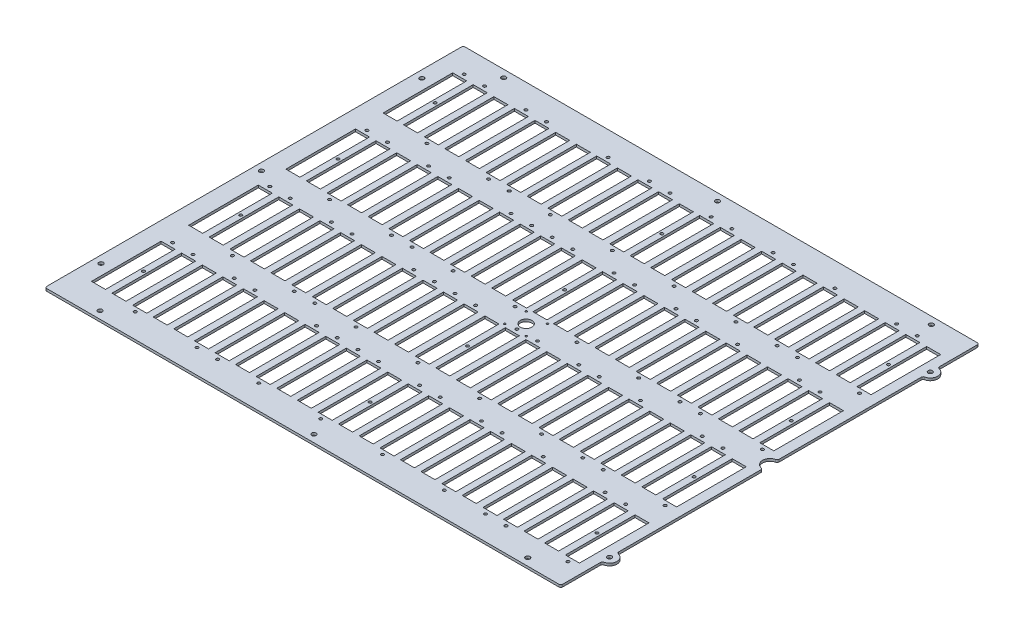
from build123d import *

# Parameters (mm, degrees)
BOSS_EXTRUDE1_DEPTH        = 3.175
SKETCH2_R                  = 1.905
SKETCH2_W                  = 18.288
SKETCH2_H                  = 90.932
CUT_EXTRUDE1_DEPTH         = 3.175
F_1_0_228_DIAMETER_HOLE1_D = 5.7912
FILLET1_R                  = 2.54
CUT_EXTRUDE3_OUTLINE_W     = 18.288
CUT_EXTRUDE3_OUTLINE_H     = 90.932
CUT_EXTRUDE3_OUTLINE_R     = 1.89865
CUT_EXTRUDE3_OUTLINE_R_2   = 2.8956
CUT_EXTRUDE3_OUTLINE_R_3   = 1.905
CUT_EXTRUDE3_DEPTH         = 3.175
CUT_EXTRUDE4_OUTLINE_R     = 1.2192
CUT_EXTRUDE4_OUTLINE_R_2   = 7.62
CUT_EXTRUDE4_DEPTH         = 3.175


# Read off the part's stored shape, not the designer's step: Cut-Extrude3, Cut-Extrude4
with BuildPart() as part:
    # Sketch1 → Boss-Extrude1 (new body)
    with BuildSketch(Plane(origin=(0, 0, 0), x_dir=(1, 0, 0), z_dir=(0, 1, 0))):
        with BuildLine():
            Line((337.058, 219.202), (337.058, 273.304))
            Line((337.058, 273.304), (-337.058, 273.304))
            Line((-337.058, 273.304), (-337.058, -273.304))
            Line((-337.058, -273.304), (337.058, -273.304))
            Line((337.058, -273.304), (337.058, -219.202))
            ThreePointArc((337.058, -219.202), (346.71, -209.55), (337.058, -199.898))
            Line((337.058, -199.898), (337.058, -9.652))
            ThreePointArc((337.058, -9.652), (327.406, 0), (337.058, 9.652))
            Line((337.058, 9.652), (337.058, 199.898))
            ThreePointArc((337.058, 199.898), (346.71, 209.55), (337.058, 219.202))
        make_face()
    extrude(amount=BOSS_EXTRUDE1_DEPTH)

    # Sketch2 → Cut-Extrude1 (cut)
    with BuildSketch(Plane(origin=(0, 3.175, 0), x_dir=(1, 0, 0), z_dir=(0, 1, 0))):
        with Locations(Location((-304.313166667, 241.808, 0), (0, 0, 270))):
            Circle(SKETCH2_R)
        with Locations(Location((-250.465166667, 139.192, 0), (0, 0, 270))):
            Circle(SKETCH2_R)
        with Locations(Location((-169.693166667, 139.192, 0), (0, 0, 270))):
            Circle(SKETCH2_R)
        with Locations(Location((-169.693166667, 12.192, 0), (0, 0, 270))):
            Circle(SKETCH2_R)
        with Locations(Location((-196.7865, 241.808, 0), (0, 0, 270))):
            Circle(SKETCH2_R)
        with Locations(Location((-169.693166667, -114.808, 0), (0, 0, 270))):
            Circle(SKETCH2_R)
        with Locations(Location((-169.693166667, -241.808, 0), (0, 0, 270))):
            Circle(SKETCH2_R)
        with Locations(Location((-116.1415, 241.808, 0), (0, 0, 270))):
            Circle(SKETCH2_R)
        with Locations(Location((-250.465166667, 12.192, 0), (0, 0, 270))):
            Circle(SKETCH2_R)
        with Locations(Location((-250.465166667, -114.808, 0), (0, 0, 270))):
            Circle(SKETCH2_R)
        with Locations(Location((-250.465166667, -241.808, 0), (0, 0, 270))):
            Circle(SKETCH2_R)
        with Locations(Location((-277.5585, 241.808, 0), (0, 0, 270))):
            Circle(SKETCH2_R)
        with Locations(Location((-277.5585, 114.808, 0), (0, 0, 270))):
            Circle(SKETCH2_R)
        with Locations(Location((-277.5585, -12.192, 0), (0, 0, 270))):
            Circle(SKETCH2_R)
        with Locations(Location((-277.5585, -139.192, 0), (0, 0, 270))):
            Circle(SKETCH2_R)
        with Locations(Location((-142.769166667, 139.192, 0), (0, 0, 270))):
            Circle(SKETCH2_R)
        with Locations(Location((-142.769166667, 12.192, 0), (0, 0, 270))):
            Circle(SKETCH2_R)
        with Locations(Location((-142.769166667, -114.808, 0), (0, 0, 270))):
            Circle(SKETCH2_R)
        with Locations(Location((-142.769166667, -241.808, 0), (0, 0, 270))):
            Circle(SKETCH2_R)
        with Locations(Location((-62.2935, 241.808, 0), (0, 0, 270))):
            Circle(SKETCH2_R)
        with Locations(Location((-62.2935, 114.808, 0), (0, 0, 270))):
            Circle(SKETCH2_R)
        with Locations(Location((-62.2935, -12.192, 0), (0, 0, 270))):
            Circle(SKETCH2_R)
        with Locations(Location((-62.2935, -139.192, 0), (0, 0, 270))):
            Circle(SKETCH2_R)
        with Locations(Location((-35.3695, 241.808, 0), (0, 0, 270))):
            Circle(SKETCH2_R)
        with Locations(Location((-35.3695, 114.808, 0), (0, 0, 270))):
            Circle(SKETCH2_R)
        with Locations(Location((-35.3695, -12.192, 0), (0, 0, 270))):
            Circle(SKETCH2_R)
        with Locations(Location((-35.3695, -139.192, 0), (0, 0, 270))):
            Circle(SKETCH2_R)
        with Locations(Location((-196.7865, 114.808, 0), (0, 0, 270))):
            Circle(SKETCH2_R)
        with Locations(Location((-8.149166667, 139.192, 0), (0, 0, 270))):
            Circle(SKETCH2_R)
        with Locations(Location((-8.149166667, 12.192, 0), (0, 0, 270))):
            Circle(SKETCH2_R)
        with Locations(Location((-116.1415, 114.808, 0), (0, 0, 270))):
            Circle(SKETCH2_R)
        with Locations(Location((-8.149166667, -114.808, 0), (0, 0, 270))):
            Circle(SKETCH2_R)
        with Locations(Location((-8.149166667, -241.808, 0), (0, 0, 270))):
            Circle(SKETCH2_R)
        with Locations(Location((18.4785, 241.808, 0), (0, 0, 270))):
            Circle(SKETCH2_R)
        with Locations(Location((18.4785, 114.808, 0), (0, 0, 270))):
            Circle(SKETCH2_R)
        with Locations(Location((18.4785, -12.192, 0), (0, 0, 270))):
            Circle(SKETCH2_R)
        with Locations(Location((18.4785, -139.192, 0), (0, 0, 270))):
            Circle(SKETCH2_R)
        with Locations(Location((45.4025, 241.808, 0), (0, 0, 270))):
            Circle(SKETCH2_R)
        with Locations(Location((45.4025, 114.808, 0), (0, 0, 270))):
            Circle(SKETCH2_R)
        with Locations(Location((45.4025, -12.192, 0), (0, 0, 270))):
            Circle(SKETCH2_R)
        with Locations(Location((45.4025, -139.192, 0), (0, 0, 270))):
            Circle(SKETCH2_R)
        with Locations(Location((126.1745, 241.808, 0), (0, 0, 270))):
            Circle(SKETCH2_R)
        with Locations(Location((126.1745, 114.808, 0), (0, 0, 270))):
            Circle(SKETCH2_R)
        with Locations(Location((126.1745, -12.192, 0), (0, 0, 270))):
            Circle(SKETCH2_R)
        with Locations(Location((126.1745, -139.192, 0), (0, 0, 270))):
            Circle(SKETCH2_R)
        with Locations(Location((180.0225, 241.808, 0), (0, 0, 270))):
            Circle(SKETCH2_R)
        with Locations(Location((180.0225, 114.808, 0), (0, 0, 270))):
            Circle(SKETCH2_R)
        with Locations(Location((180.0225, -12.192, 0), (0, 0, 270))):
            Circle(SKETCH2_R)
        with Locations(Location((180.0225, -139.192, 0), (0, 0, 270))):
            Circle(SKETCH2_R)
        with Locations(Location((260.7945, 241.808, 0), (0, 0, 270))):
            Circle(SKETCH2_R)
        with Locations(Location((-196.7865, -12.192, 0), (0, 0, 270))):
            Circle(SKETCH2_R)
        with Locations(Location((260.7945, 114.808, 0), (0, 0, 270))):
            Circle(SKETCH2_R)
        with Locations(Location((260.7945, -12.192, 0), (0, 0, 270))):
            Circle(SKETCH2_R)
        with Locations(Location((-116.1415, -12.192, 0), (0, 0, 270))):
            Circle(SKETCH2_R)
        with Locations(Location((260.7945, -139.192, 0), (0, 0, 270))):
            Circle(SKETCH2_R)
        with Locations(Location((287.7185, 241.808, 0), (0, 0, 270))):
            Circle(SKETCH2_R)
        with Locations(Location((287.7185, 114.808, 0), (0, 0, 270))):
            Circle(SKETCH2_R)
        with Locations(Location((287.7185, -12.192, 0), (0, 0, 270))):
            Circle(SKETCH2_R)
        with Locations(Location((287.7185, -139.192, 0), (0, 0, 270))):
            Circle(SKETCH2_R)
        with Locations(Location((72.622833333, 139.192, 0), (0, 0, 270))):
            Circle(SKETCH2_R)
        with Locations(Location((72.622833333, 12.192, 0), (0, 0, 270))):
            Circle(SKETCH2_R)
        with Locations(Location((72.622833333, -114.808, 0), (0, 0, 270))):
            Circle(SKETCH2_R)
        with Locations(Location((72.622833333, -241.808, 0), (0, 0, 270))):
            Circle(SKETCH2_R)
        with Locations(Location((153.394833333, 139.192, 0), (0, 0, 270))):
            Circle(SKETCH2_R)
        with Locations(Location((153.394833333, 12.192, 0), (0, 0, 270))):
            Circle(SKETCH2_R)
        with Locations(Location((153.394833333, -114.808, 0), (0, 0, 270))):
            Circle(SKETCH2_R)
        with Locations(Location((153.394833333, -241.808, 0), (0, 0, 270))):
            Circle(SKETCH2_R)
        with Locations(Location((207.242833333, 139.192, 0), (0, 0, 270))):
            Circle(SKETCH2_R)
        with Locations(Location((207.242833333, 12.192, 0), (0, 0, 270))):
            Circle(SKETCH2_R)
        with Locations(Location((207.242833333, -114.808, 0), (0, 0, 270))):
            Circle(SKETCH2_R)
        with Locations(Location((207.242833333, -241.808, 0), (0, 0, 270))):
            Circle(SKETCH2_R)
        with Locations(Location((314.938833333, 139.192, 0), (0, 0, 270))):
            Circle(SKETCH2_R)
        with Locations(Location((314.938833333, 12.192, 0), (0, 0, 270))):
            Circle(SKETCH2_R)
        with Locations(Location((-196.7865, -139.192, 0), (0, 0, 270))):
            Circle(SKETCH2_R)
        with Locations(Location((314.938833333, -114.808, 0), (0, 0, 270))):
            Circle(SKETCH2_R)
        with Locations(Location((314.938833333, -241.808, 0), (0, 0, 270))):
            Circle(SKETCH2_R)
        with Locations(Location((-116.1415, -139.192, 0), (0, 0, 270))):
            Circle(SKETCH2_R)
        with Locations(Location((-304.313166667, 114.808, 0), (0, 0, 270))):
            Circle(SKETCH2_R)
        with Locations(Location((-304.313166667, -12.192, 0), (0, 0, 270))):
            Circle(SKETCH2_R)
        with Locations(Location((-304.313166667, -139.192, 0), (0, 0, 270))):
            Circle(SKETCH2_R)
        with Locations((-250.465166667, 190.5)):
            Rectangle(SKETCH2_W, SKETCH2_H)
        with Locations((-169.693166667, 190.5)):
            Rectangle(SKETCH2_W, SKETCH2_H)
        with Locations((-304.313166667, 190.5)):
            Rectangle(SKETCH2_W, SKETCH2_H)
        with Locations((-169.693166667, 63.5)):
            Rectangle(SKETCH2_W, SKETCH2_H)
        with Locations((-169.693166667, -63.5)):
            Rectangle(SKETCH2_W, SKETCH2_H)
        with Locations((-196.7865, 190.5)):
            Rectangle(SKETCH2_W, SKETCH2_H)
        with Locations((-169.693166667, -190.5)):
            Rectangle(SKETCH2_W, SKETCH2_H)
        with Locations((-250.465166667, 63.5)):
            Rectangle(SKETCH2_W, SKETCH2_H)
        with Locations((-116.1415, 190.5)):
            Rectangle(SKETCH2_W, SKETCH2_H)
        with Locations((-250.465166667, -63.5)):
            Rectangle(SKETCH2_W, SKETCH2_H)
        with Locations((-250.465166667, -190.5)):
            Rectangle(SKETCH2_W, SKETCH2_H)
        with Locations((-277.5585, 190.5)):
            Rectangle(SKETCH2_W, SKETCH2_H)
        with Locations((-277.5585, 63.5)):
            Rectangle(SKETCH2_W, SKETCH2_H)
        with Locations((-277.5585, -63.5)):
            Rectangle(SKETCH2_W, SKETCH2_H)
        with Locations((-277.5585, -190.5)):
            Rectangle(SKETCH2_W, SKETCH2_H)
        with Locations((-142.769166667, 190.5)):
            Rectangle(SKETCH2_W, SKETCH2_H)
        with Locations((-142.769166667, 63.5)):
            Rectangle(SKETCH2_W, SKETCH2_H)
        with Locations((-142.769166667, -63.5)):
            Rectangle(SKETCH2_W, SKETCH2_H)
        with Locations((-142.769166667, -190.5)):
            Rectangle(SKETCH2_W, SKETCH2_H)
        with Locations((-62.2935, 190.5)):
            Rectangle(SKETCH2_W, SKETCH2_H)
        with Locations((-62.2935, 63.5)):
            Rectangle(SKETCH2_W, SKETCH2_H)
        with Locations((-62.2935, -63.5)):
            Rectangle(SKETCH2_W, SKETCH2_H)
        with Locations((-62.2935, -190.5)):
            Rectangle(SKETCH2_W, SKETCH2_H)
        with Locations((-35.3695, 190.5)):
            Rectangle(SKETCH2_W, SKETCH2_H)
        with Locations((-35.3695, 63.5)):
            Rectangle(SKETCH2_W, SKETCH2_H)
        with Locations((-35.3695, -63.5)):
            Rectangle(SKETCH2_W, SKETCH2_H)
        with Locations((-35.3695, -190.5)):
            Rectangle(SKETCH2_W, SKETCH2_H)
        with Locations((-8.149166667, 190.5)):
            Rectangle(SKETCH2_W, SKETCH2_H)
        with Locations((-196.7865, 63.5)):
            Rectangle(SKETCH2_W, SKETCH2_H)
        with Locations((-8.149166667, 63.5)):
            Rectangle(SKETCH2_W, SKETCH2_H)
        with Locations((-8.149166667, -63.5)):
            Rectangle(SKETCH2_W, SKETCH2_H)
        with Locations((-116.1415, 63.5)):
            Rectangle(SKETCH2_W, SKETCH2_H)
        with Locations((-8.149166667, -190.5)):
            Rectangle(SKETCH2_W, SKETCH2_H)
        with Locations((18.4785, 190.5)):
            Rectangle(SKETCH2_W, SKETCH2_H)
        with Locations((18.4785, 63.5)):
            Rectangle(SKETCH2_W, SKETCH2_H)
        with Locations((18.4785, -63.5)):
            Rectangle(SKETCH2_W, SKETCH2_H)
        with Locations((18.4785, -190.5)):
            Rectangle(SKETCH2_W, SKETCH2_H)
        with Locations((45.4025, 190.5)):
            Rectangle(SKETCH2_W, SKETCH2_H)
        with Locations((45.4025, 63.5)):
            Rectangle(SKETCH2_W, SKETCH2_H)
        with Locations((45.4025, -63.5)):
            Rectangle(SKETCH2_W, SKETCH2_H)
        with Locations((45.4025, -190.5)):
            Rectangle(SKETCH2_W, SKETCH2_H)
        with Locations((126.1745, 190.5)):
            Rectangle(SKETCH2_W, SKETCH2_H)
        with Locations((126.1745, 63.5)):
            Rectangle(SKETCH2_W, SKETCH2_H)
        with Locations((126.1745, -63.5)):
            Rectangle(SKETCH2_W, SKETCH2_H)
        with Locations((126.1745, -190.5)):
            Rectangle(SKETCH2_W, SKETCH2_H)
        with Locations((180.0225, 190.5)):
            Rectangle(SKETCH2_W, SKETCH2_H)
        with Locations((180.0225, 63.5)):
            Rectangle(SKETCH2_W, SKETCH2_H)
        with Locations((180.0225, -63.5)):
            Rectangle(SKETCH2_W, SKETCH2_H)
        with Locations((180.0225, -190.5)):
            Rectangle(SKETCH2_W, SKETCH2_H)
        with Locations((260.7945, 190.5)):
            Rectangle(SKETCH2_W, SKETCH2_H)
        with Locations((260.7945, 63.5)):
            Rectangle(SKETCH2_W, SKETCH2_H)
        with Locations((-196.7865, -63.5)):
            Rectangle(SKETCH2_W, SKETCH2_H)
        with Locations((260.7945, -63.5)):
            Rectangle(SKETCH2_W, SKETCH2_H)
        with Locations((260.7945, -190.5)):
            Rectangle(SKETCH2_W, SKETCH2_H)
        with Locations((-116.1415, -63.5)):
            Rectangle(SKETCH2_W, SKETCH2_H)
        with Locations((287.7185, 190.5)):
            Rectangle(SKETCH2_W, SKETCH2_H)
        with Locations((287.7185, 63.5)):
            Rectangle(SKETCH2_W, SKETCH2_H)
        with Locations((287.7185, -63.5)):
            Rectangle(SKETCH2_W, SKETCH2_H)
        with Locations((287.7185, -190.5)):
            Rectangle(SKETCH2_W, SKETCH2_H)
        with Locations((72.622833333, 190.5)):
            Rectangle(SKETCH2_W, SKETCH2_H)
        with Locations((72.622833333, 63.5)):
            Rectangle(SKETCH2_W, SKETCH2_H)
        with Locations((72.622833333, -63.5)):
            Rectangle(SKETCH2_W, SKETCH2_H)
        with Locations((72.622833333, -190.5)):
            Rectangle(SKETCH2_W, SKETCH2_H)
        with Locations((153.394833333, 190.5)):
            Rectangle(SKETCH2_W, SKETCH2_H)
        with Locations((153.394833333, 63.5)):
            Rectangle(SKETCH2_W, SKETCH2_H)
        with Locations((153.394833333, -63.5)):
            Rectangle(SKETCH2_W, SKETCH2_H)
        with Locations((153.394833333, -190.5)):
            Rectangle(SKETCH2_W, SKETCH2_H)
        with Locations((207.242833333, 190.5)):
            Rectangle(SKETCH2_W, SKETCH2_H)
        with Locations((207.242833333, 63.5)):
            Rectangle(SKETCH2_W, SKETCH2_H)
        with Locations((207.242833333, -63.5)):
            Rectangle(SKETCH2_W, SKETCH2_H)
        with Locations((207.242833333, -190.5)):
            Rectangle(SKETCH2_W, SKETCH2_H)
        with Locations((314.938833333, 190.5)):
            Rectangle(SKETCH2_W, SKETCH2_H)
        with Locations((314.938833333, 63.5)):
            Rectangle(SKETCH2_W, SKETCH2_H)
        with Locations((-196.7865, -190.5)):
            Rectangle(SKETCH2_W, SKETCH2_H)
        with Locations((314.938833333, -63.5)):
            Rectangle(SKETCH2_W, SKETCH2_H)
        with Locations((314.938833333, -190.5)):
            Rectangle(SKETCH2_W, SKETCH2_H)
        with Locations((-116.1415, -190.5)):
            Rectangle(SKETCH2_W, SKETCH2_H)
        with Locations((-304.313166667, 63.5)):
            Rectangle(SKETCH2_W, SKETCH2_H)
        with Locations((-304.313166667, -63.5)):
            Rectangle(SKETCH2_W, SKETCH2_H)
        with Locations((-304.313166667, -190.5)):
            Rectangle(SKETCH2_W, SKETCH2_H)
    extrude(amount=-CUT_EXTRUDE1_DEPTH, mode=Mode.SUBTRACT)

    # #1 (0.228) Diameter Hole1 (through all)
    with Locations(Plane(origin=(0, 3.175, 0), x_dir=(1, 0, 0), z_dir=(0, 1, 0))):
        with Locations((337.058, 209.55), (337.058, -209.55)):
            Hole(F_1_0_228_DIAMETER_HOLE1_D / 2)

    # Fillet1
    fillet1_edges = [part.edges().sort_by_distance(p)[0] for p in [
        (337.058, 1.5875, -273.304),
        (337.058, 1.5875, -219.202),
        (337.058, 1.5875, -199.898),
        (337.058, 1.5875, -9.652),
        (337.058, 1.5875, 9.652),
        (337.058, 1.5875, 199.898),
        (337.058, 1.5875, 219.202),
        (337.058, 1.5875, 273.304),
        (-337.058, 1.5875, 273.304),
        (-337.058, 1.5875, -273.304),
    ]]
    fillet(fillet1_edges, radius=FILLET1_R)

    # Cut-Extrude3 outline → Cut-Extrude3 (cut)
    with BuildSketch(Plane(origin=(0, 0, 0), x_dir=(1, 0, 0), z_dir=(0, 1, 0))):
        with Locations((233.9975, 190.5)):
            Rectangle(CUT_EXTRUDE3_OUTLINE_W, CUT_EXTRUDE3_OUTLINE_H)
        with Locations((99.3775, 190.5)):
            Rectangle(CUT_EXTRUDE3_OUTLINE_W, CUT_EXTRUDE3_OUTLINE_H)
        with Locations((-223.7105, 190.5)):
            Rectangle(CUT_EXTRUDE3_OUTLINE_W, CUT_EXTRUDE3_OUTLINE_H)
        with Locations((-89.0905, 190.5)):
            Rectangle(CUT_EXTRUDE3_OUTLINE_W, CUT_EXTRUDE3_OUTLINE_H)
        with Locations((-223.7105, -190.5)):
            Rectangle(CUT_EXTRUDE3_OUTLINE_W, CUT_EXTRUDE3_OUTLINE_H)
        with Locations((-89.0905, -190.5)):
            Rectangle(CUT_EXTRUDE3_OUTLINE_W, CUT_EXTRUDE3_OUTLINE_H)
        with Locations((233.9975, -190.5)):
            Rectangle(CUT_EXTRUDE3_OUTLINE_W, CUT_EXTRUDE3_OUTLINE_H)
        with Locations((99.3775, -190.5)):
            Rectangle(CUT_EXTRUDE3_OUTLINE_W, CUT_EXTRUDE3_OUTLINE_H)
        with Locations((-223.7105, -63.5)):
            Rectangle(CUT_EXTRUDE3_OUTLINE_W, CUT_EXTRUDE3_OUTLINE_H)
        with Locations((-89.0905, -63.5)):
            Rectangle(CUT_EXTRUDE3_OUTLINE_W, CUT_EXTRUDE3_OUTLINE_H)
        with Locations((233.9975, -63.5)):
            Rectangle(CUT_EXTRUDE3_OUTLINE_W, CUT_EXTRUDE3_OUTLINE_H)
        with Locations((99.3775, -63.5)):
            Rectangle(CUT_EXTRUDE3_OUTLINE_W, CUT_EXTRUDE3_OUTLINE_H)
        with Locations((-223.7105, 63.5)):
            Rectangle(CUT_EXTRUDE3_OUTLINE_W, CUT_EXTRUDE3_OUTLINE_H)
        with Locations((-89.0905, 63.5)):
            Rectangle(CUT_EXTRUDE3_OUTLINE_W, CUT_EXTRUDE3_OUTLINE_H)
        with Locations((99.3775, 63.5)):
            Rectangle(CUT_EXTRUDE3_OUTLINE_W, CUT_EXTRUDE3_OUTLINE_H)
        with Locations((233.9975, 63.5)):
            Rectangle(CUT_EXTRUDE3_OUTLINE_W, CUT_EXTRUDE3_OUTLINE_H)
        with Locations((-290.935833333, -190.5)):
            Circle(CUT_EXTRUDE3_OUTLINE_R)
        with Locations((-290.935833333, -63.5)):
            Circle(CUT_EXTRUDE3_OUTLINE_R)
        with Locations((-290.935833333, 63.5)):
            Circle(CUT_EXTRUDE3_OUTLINE_R)
        with Locations((301.392166667, -190.5)):
            Circle(CUT_EXTRUDE3_OUTLINE_R)
        with Locations((5.228166667, -190.5)):
            Circle(CUT_EXTRUDE3_OUTLINE_R)
        with Locations((301.392166667, -63.5)):
            Circle(CUT_EXTRUDE3_OUTLINE_R)
        with Locations((5.228166667, -63.5)):
            Circle(CUT_EXTRUDE3_OUTLINE_R)
        with Locations((301.392166667, 63.5)):
            Circle(CUT_EXTRUDE3_OUTLINE_R)
        with Locations((5.228166667, 63.5)):
            Circle(CUT_EXTRUDE3_OUTLINE_R)
        with Locations((301.392166667, 190.5)):
            Circle(CUT_EXTRUDE3_OUTLINE_R)
        with Locations((5.228166667, 190.5)):
            Circle(CUT_EXTRUDE3_OUTLINE_R)
        with Locations((-290.935833333, 190.5)):
            Circle(CUT_EXTRUDE3_OUTLINE_R)
        with Locations((4.826, 263.652)):
            Circle(CUT_EXTRUDE3_OUTLINE_R_2)
        with Locations((-274.574, 263.652)):
            Circle(CUT_EXTRUDE3_OUTLINE_R_2)
        with Locations((-327.406, 209.55)):
            Circle(CUT_EXTRUDE3_OUTLINE_R_2)
        with Locations((-327.406, 0)):
            Circle(CUT_EXTRUDE3_OUTLINE_R_2)
        with Locations((-327.406, -209.55)):
            Circle(CUT_EXTRUDE3_OUTLINE_R_2)
        with Locations((-274.574, -263.652)):
            Circle(CUT_EXTRUDE3_OUTLINE_R_2)
        with Locations((4.826, -263.652)):
            Circle(CUT_EXTRUDE3_OUTLINE_R_2)
        with Locations((284.226, -263.652)):
            Circle(CUT_EXTRUDE3_OUTLINE_R_2)
        with Locations((284.226, 263.652)):
            Circle(CUT_EXTRUDE3_OUTLINE_R_2)
        with Locations((-223.7105, 114.808)):
            Circle(CUT_EXTRUDE3_OUTLINE_R_3)
        with Locations((-89.0905, -139.192)):
            Circle(CUT_EXTRUDE3_OUTLINE_R_3)
        with Locations((99.3775, 241.808)):
            Circle(CUT_EXTRUDE3_OUTLINE_R_3)
        with Locations((-223.7105, -139.192)):
            Circle(CUT_EXTRUDE3_OUTLINE_R_3)
        with Locations((-223.7105, -12.192)):
            Circle(CUT_EXTRUDE3_OUTLINE_R_3)
        with Locations((-223.7105, 241.808)):
            Circle(CUT_EXTRUDE3_OUTLINE_R_3)
        with Locations((-89.0905, -12.192)):
            Circle(CUT_EXTRUDE3_OUTLINE_R_3)
        with Locations((-89.0905, 114.808)):
            Circle(CUT_EXTRUDE3_OUTLINE_R_3)
        with Locations((99.3775, -139.192)):
            Circle(CUT_EXTRUDE3_OUTLINE_R_3)
        with Locations((-89.0905, 139.192)):
            Circle(CUT_EXTRUDE3_OUTLINE_R_3)
        with Locations((233.9975, 139.192)):
            Circle(CUT_EXTRUDE3_OUTLINE_R_3)
        with Locations((233.9975, 12.192)):
            Circle(CUT_EXTRUDE3_OUTLINE_R_3)
        with Locations((233.9975, -114.808)):
            Circle(CUT_EXTRUDE3_OUTLINE_R_3)
        with Locations((233.9975, -241.808)):
            Circle(CUT_EXTRUDE3_OUTLINE_R_3)
        with Locations((-89.0905, 12.192)):
            Circle(CUT_EXTRUDE3_OUTLINE_R_3)
        with Locations((-89.0905, -114.808)):
            Circle(CUT_EXTRUDE3_OUTLINE_R_3)
        with Locations((-89.0905, -241.808)):
            Circle(CUT_EXTRUDE3_OUTLINE_R_3)
        with Locations((99.3775, -12.192)):
            Circle(CUT_EXTRUDE3_OUTLINE_R_3)
        with Locations((99.3775, 114.808)):
            Circle(CUT_EXTRUDE3_OUTLINE_R_3)
    extrude(amount=CUT_EXTRUDE3_DEPTH, mode=Mode.SUBTRACT)

    # Cut-Extrude4 outline → Cut-Extrude4 (cut)
    with BuildSketch(Plane(origin=(0, 0, 0), x_dir=(1, 0, 0), z_dir=(0, 1, 0))):
        with Locations((32.4485, -13.97)):
            Circle(CUT_EXTRUDE4_OUTLINE_R)
        with Locations((4.5085, 13.97)):
            Circle(CUT_EXTRUDE4_OUTLINE_R)
        with Locations((4.5085, -13.97)):
            Circle(CUT_EXTRUDE4_OUTLINE_R)
        with Locations((32.4485, 13.97)):
            Circle(CUT_EXTRUDE4_OUTLINE_R)
        with Locations((18.4785, 0)):
            Circle(CUT_EXTRUDE4_OUTLINE_R_2)
    extrude(amount=CUT_EXTRUDE4_DEPTH, mode=Mode.SUBTRACT)


solid = part.part
